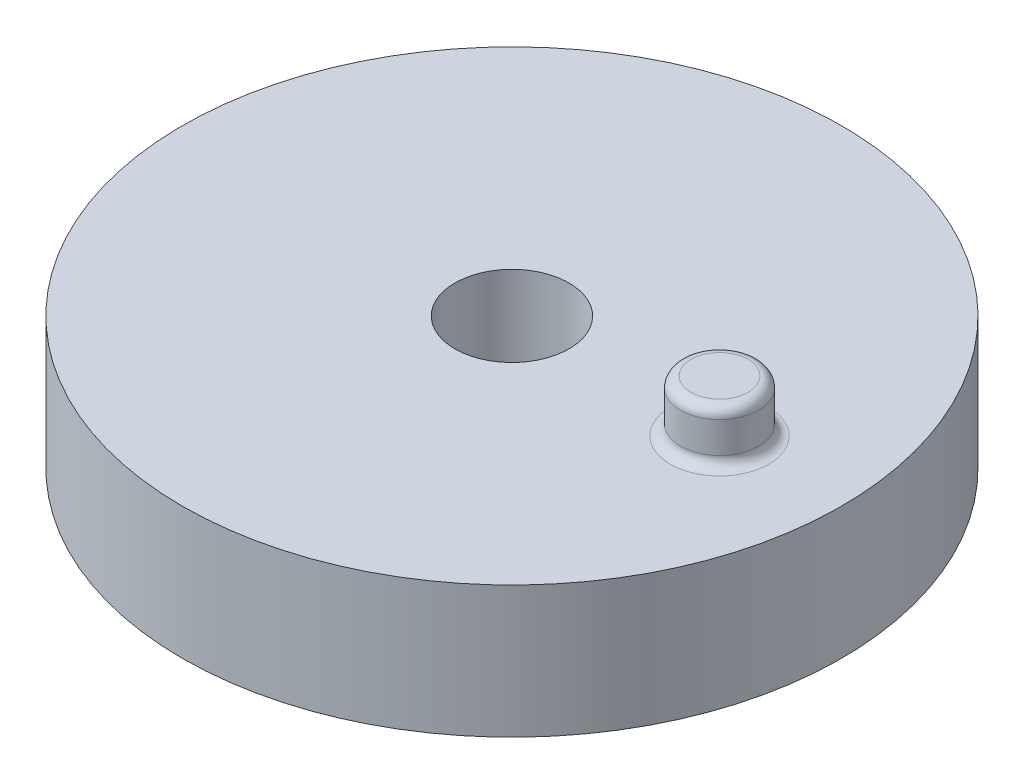
from build123d import *

# Parameters (mm, degrees)
SKETCH1_R           = 63.5
BOSS_EXTRUDE1_DEPTH = 25.4
SKETCH2_R           = 7.5
BOSS_EXTRUDE2_DEPTH = 10
FILLET1_R           = 2
SKETCH3_R           = 11
CUT_EXTRUDE1_DEPTH  = 94.3255592


with BuildPart() as part:
    # Sketch1 → Boss-Extrude1 (new body)
    with BuildSketch(Plane(origin=(0, 0, 0), x_dir=(1, 0, 0), z_dir=(0, 1, 0))):
        Circle(SKETCH1_R)
    extrude(amount=BOSS_EXTRUDE1_DEPTH)

    # Sketch2 → Boss-Extrude2 (add)
    with BuildSketch(Plane(origin=(0, 25.4, 0), x_dir=(1, 0, 0), z_dir=(0, 1, 0))):
        with Locations((40, 0)):
            Circle(SKETCH2_R)
    extrude(amount=BOSS_EXTRUDE2_DEPTH)

    # Fillet1
    fillet1_edges = [part.edges().sort_by_distance(p)[0] for p in [
        (32.5, 25.4, 0),
        (32.5, 35.4, 0),
    ]]
    fillet(fillet1_edges, radius=FILLET1_R)

    # Sketch3 → Cut-Extrude1 (cut, through all)
    with BuildSketch(Plane(origin=(0, 25.4, 0), x_dir=(1, 0, 0), z_dir=(0, 1, 0))):
        Circle(SKETCH3_R)
    extrude(amount=-CUT_EXTRUDE1_DEPTH, mode=Mode.SUBTRACT)


solid = part.part
